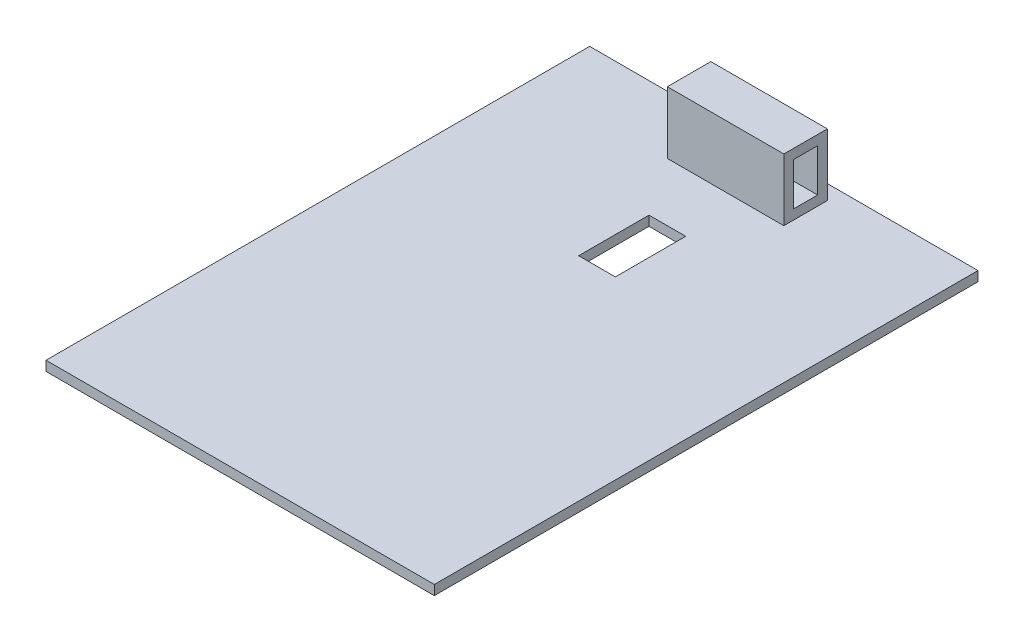
from build123d import *

# Parameters (mm, degrees)
SKETCH1_W           = 127
SKETCH1_H           = 177.8
SKETCH1_W_2         = 12
SKETCH1_H_2         = 23
BOSS_EXTRUDE2_DEPTH = 3.175
SKETCH5_W           = 38.1
SKETCH5_H           = 20.32
BOSS_EXTRUDE3_DEPTH = 14.224
CUT_EXTRUDE1_REACH  = 199.432
SKETCH8_W           = 7.874
SKETCH8_H           = 13.97


with BuildPart() as part:
    # Sketch1 → Boss-Extrude2 (new body)
    with BuildSketch(Plane(origin=(0, 0, 0), x_dir=(1, 0, 0), z_dir=(0, 1, 0))):
        with Locations((63.5, 88.9)):
            Rectangle(SKETCH1_W, SKETCH1_H)
        with Locations((63.5, 128.2)):
            Rectangle(SKETCH1_W_2, SKETCH1_H_2, mode=Mode.SUBTRACT)
    extrude(amount=BOSS_EXTRUDE2_DEPTH)

    # Sketch5 → Boss-Extrude3 (add)
    with BuildSketch(Plane(origin=(0, 0, -158.75), x_dir=(-1, 0, 0), z_dir=(0, 0, -1))):
        with Locations((-63.5, 13.335)):
            Rectangle(SKETCH5_W, SKETCH5_H)
    extrude(amount=BOSS_EXTRUDE3_DEPTH)

    # Sketch8 → Cut-Extrude1 (cut, up to next)
    with BuildSketch(Plane(origin=(82.55, 0, 0), x_dir=(0, 0, -1), z_dir=(1, 0, 0)), mode=Mode.PRIVATE) as cut_extrude1_sk1:
        with Locations((165.862, 13.335)):
            Rectangle(SKETCH8_W, SKETCH8_H)
    cut_extrude1_tool1 = extrude(cut_extrude1_sk1.sketch, amount=-CUT_EXTRUDE1_REACH, mode=Mode.PRIVATE) & part.part
    add(cut_extrude1_tool1.solids().sort_by_distance((82.55, 13.335, -165.862))[0], mode=Mode.SUBTRACT)


solid = part.part
